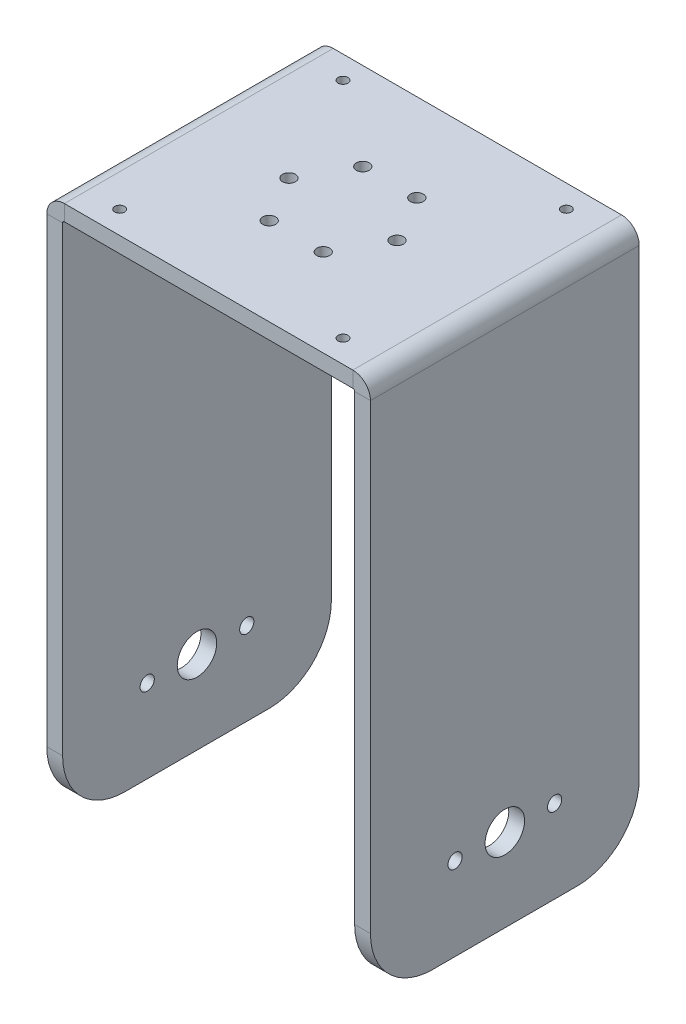
from build123d import *

# Parameters (mm, degrees)
SKETCH3_W                    = 130
SKETCH3_H                    = 107.95
BASE_FLANGE1_DEPTH           = 6.35
EDGE_FLANGE1_STRIP_W         = 26.8732
EDGE_FLANGE1_STRIP_H         = 6.35
EDGE_FLANGE1_STRIP_CUT_DEPTH = 107.95
EDGE_FLANGE1_DEPTH           = 107.95
EDGE_FLANGE1_PROFILE_W       = 107.95
EDGE_FLANGE1_PROFILE_H       = 210.4009
EDGE_FLANGE1_PROFILE_R       = 2.855235605
EDGE_FLANGE1_PROFILE_R_2     = 7.9375
EDGE_FLANGE1_FLAT_DEPTH      = 6.35
FILLET1_R                    = 25
SKETCH13_R                   = 2.6
FLANGE_COUPLING_HOLES_DEPTH  = 234.321909133
SKETCH15_R                   = 1.985
CUT_EXTRUDE1_DEPTH           = 234.321909133


# Sheet-metal steps are written as plain solids
with BuildPart() as part:
    # Sketch3 → Base-Flange1 (new body)
    with BuildSketch(Plane(origin=(0, 0, 0), x_dir=(1, 0, 0), z_dir=(0, 1, 0))):
        Rectangle(SKETCH3_W, SKETCH3_H)
    extrude(amount=-BASE_FLANGE1_DEPTH)

    # Edge-Flange1 strip (across the edge) → Edge-Flange1 strip cut (cut)
    with BuildSketch(Plane(origin=(65, -6.35, -53.975), x_dir=(-1, 0, 0), z_dir=(0, 0, 1))):
        with Locations((-6.35, -3.175)):
            Rectangle(EDGE_FLANGE1_STRIP_W, EDGE_FLANGE1_STRIP_H)
    edge_flange1_strip_cut = extrude(amount=EDGE_FLANGE1_STRIP_CUT_DEPTH, mode=Mode.SUBTRACT)

    # Edge-Flange1 bend section (across the edge) → Edge-Flange1 (add)
    with BuildSketch(Plane(origin=(65, -6.35, -53.975), x_dir=(-1, 0, 0), z_dir=(0, 0, 1))):
        with BuildLine():
            Line((0, 0.7366), (6.35, 0.7366))
            ThreePointArc((6.35, 0.7366), (6.565745145, 0.215745145), (7.0866, 0))
            Line((7.0866, 0), (7.0866, -6.35))
            ThreePointArc((7.0866, -6.35), (2.075617084, -4.274382916), (0, 0.7366))
        make_face()
    edge_flange1 = extrude(amount=EDGE_FLANGE1_DEPTH)

    # Edge-Flange1 profile (on flange) → Edge-Flange1 flat (add)
    with BuildSketch(Plane(origin=(65, -6.35, 0), x_dir=(0, 0, -1), z_dir=(-1, 0, 0))):
        with Locations((0, 105.93705)):
            Rectangle(EDGE_FLANGE1_PROFILE_W, EDGE_FLANGE1_PROFILE_H)
        with Locations((20, 177.8)):
            Circle(EDGE_FLANGE1_PROFILE_R, mode=Mode.SUBTRACT)
        with Locations((0, 177.8)):
            Circle(EDGE_FLANGE1_PROFILE_R_2, mode=Mode.SUBTRACT)
        with Locations((-20, 177.8)):
            Circle(EDGE_FLANGE1_PROFILE_R, mode=Mode.SUBTRACT)
    edge_flange1_flat = extrude(amount=EDGE_FLANGE1_FLAT_DEPTH)

    # Mirror1: Edge-Flange1 strip cut, Edge-Flange1, Edge-Flange1 flat across plane
    add(edge_flange1_strip_cut.mirror(Plane(origin=(0, 0, 0), x_dir=(0, 0, 1), z_dir=(1, 0, 0))), mode=Mode.SUBTRACT)
    add(edge_flange1.mirror(Plane(origin=(0, 0, 0), x_dir=(0, 0, 1), z_dir=(1, 0, 0))))
    add(edge_flange1_flat.mirror(Plane(origin=(0, 0, 0), x_dir=(0, 0, 1), z_dir=(1, 0, 0))))

    # Fillet1
    fillet1_edges = [part.edges().sort_by_distance(p)[0] for p in [
        (61.825, -217.4875, -53.975),
        (61.825, -217.4875, 53.975),
        (-61.825, -217.4875, 53.975),
        (-61.825, -217.4875, -53.975),
    ]]
    fillet(fillet1_edges, radius=FILLET1_R)

    # Sketch13 → Flange Coupling Holes (cut, through all)
    with BuildSketch(Plane(origin=(0, 0, 0), x_dir=(1, 0, 0), z_dir=(0, 1, 0))):
        with Locations(Location((-21.7, 0, 0), (0, 0, 270))):
            Circle(SKETCH13_R)
        with Locations(Location((-10.85, 18.792751262, 0), (0, 0, 270))):
            Circle(SKETCH13_R)
        with Locations(Location((10.85, 18.792751262, 0), (0, 0, 270))):
            Circle(SKETCH13_R)
        with Locations(Location((21.7, 0, 0), (0, 0, 270))):
            Circle(SKETCH13_R)
        with Locations(Location((10.85, -18.792751262, 0), (0, 0, 270))):
            Circle(SKETCH13_R)
        with Locations(Location((-10.85, -18.792751262, 0), (0, 0, 270))):
            Circle(SKETCH13_R)
    extrude(amount=-FLANGE_COUPLING_HOLES_DEPTH, mode=Mode.SUBTRACT)

    # Sketch15 → Cut-Extrude1 (cut, through all)
    with BuildSketch(Plane(origin=(0, 0, 0), x_dir=(1, 0, 0), z_dir=(0, 1, 0))):
        with Locations(Location((-44.845, 44.845, 0), (0, 0, 270))):
            Circle(SKETCH15_R)
        with Locations(Location((44.845, 44.845, 0), (0, 0, 270))):
            Circle(SKETCH15_R)
        with Locations(Location((44.845, -44.845, 0), (0, 0, 270))):
            Circle(SKETCH15_R)
        with Locations(Location((-44.845, -44.845, 0), (0, 0, 270))):
            Circle(SKETCH15_R)
    extrude(amount=-CUT_EXTRUDE1_DEPTH, mode=Mode.SUBTRACT)


solid = part.part
